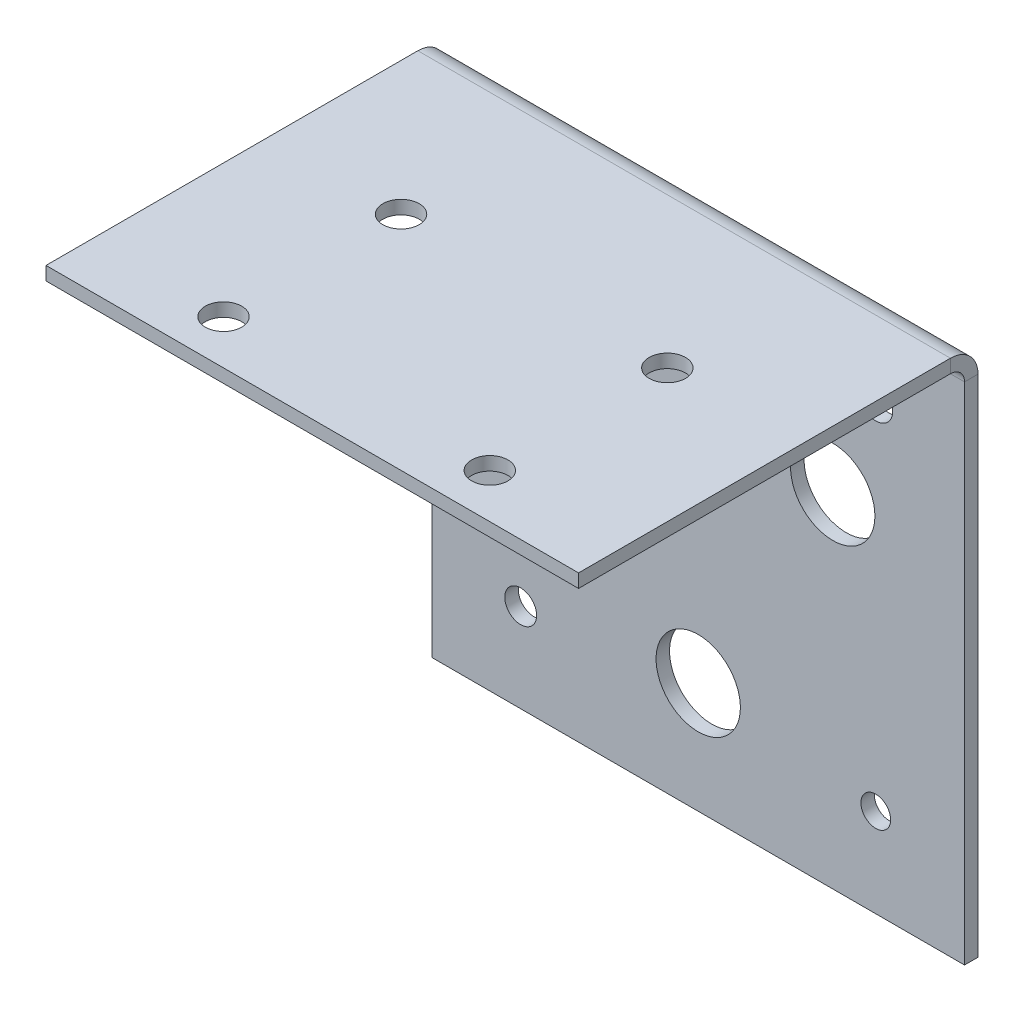
from build123d import *

# Parameters (mm, degrees)
CROQUIS1_W                       = 120
CROQUIS1_H                       = 120
CROQUIS1_R                       = 9.5
BRIDA_BASE1_DEPTH                = 3.03784
BRIDA_DE_ARISTA1_STRIP_W         = 18.50136
BRIDA_DE_ARISTA1_STRIP_H         = 3.03784
BRIDA_DE_ARISTA1_STRIP_CUT_DEPTH = 120
BRIDA_DE_ARISTA1_DEPTH           = 120
CORTAR_EXTRUIR1_REACH            = 161.883
CROQUIS9_R                       = 4.1
CORTAR_EXTRUIR2_REACH            = 125.693
CROQUIS10_R                      = 3.828194302
CROQUIS10_R_2                    = 3.588932158
CROQUIS10_R_3                    = 3.349670014


# Sheet-metal steps are written as plain solids
with BuildPart() as part:
    # Croquis1 → Brida base1 (new body)
    with BuildSketch(Plane.XY):
        Rectangle(CROQUIS1_W, CROQUIS1_H)
        with Locations((0, -35)):
            Circle(CROQUIS1_R, mode=Mode.SUBTRACT)
        with Locations((-30.310889132, 17.5)):
            Circle(CROQUIS1_R, mode=Mode.SUBTRACT)
        with Locations((30.310889132, 17.5)):
            Circle(CROQUIS1_R, mode=Mode.SUBTRACT)
    extrude(amount=-BRIDA_BASE1_DEPTH)

    # Brida de arista1 strip (across the edge) → Brida de arista1 strip cut (cut)
    with BuildSketch(Plane(origin=(60, 60, 0), x_dir=(0, -1, 0), z_dir=(-1, 0, 0))):
        with Locations((-3.03784, -1.51892)):
            Rectangle(BRIDA_DE_ARISTA1_STRIP_W, BRIDA_DE_ARISTA1_STRIP_H)
    extrude(amount=BRIDA_DE_ARISTA1_STRIP_CUT_DEPTH, mode=Mode.SUBTRACT)

    # Brida de arista1 section (across the edge) → Brida de arista1 (add)
    with BuildSketch(Plane(origin=(60, 60, 0), x_dir=(0, -1, 0), z_dir=(-1, 0, 0))):
        with BuildLine():
            Line((0, 3.175), (0, 86.96216))
            Line((0, 86.96216), (3.03784, 86.96216))
            Line((3.03784, 86.96216), (3.03784, 3.175))
            ThreePointArc((3.03784, 3.175), (3.96777597, 0.92993597), (6.21284, 0))
            Line((6.21284, 0), (6.21284, -3.03784))
            ThreePointArc((6.21284, -3.03784), (1.819698706, -1.218141294), (0, 3.175))
        make_face()
    extrude(amount=BRIDA_DE_ARISTA1_DEPTH)

    # Croquis9 → Cortar-Extruir1 (cut, up to next)
    with BuildSketch(Plane(origin=(0, 60, 0), x_dir=(1, 0, 0), z_dir=(0, 1, 0)), mode=Mode.PRIVATE) as cortar_extruir1_sk1:
        with Locations(Location((-30, -76.96216, 0), (0, 0, 270))):
            Circle(CROQUIS9_R)
    cortar_extruir1_tool1 = extrude(cortar_extruir1_sk1.sketch, amount=-CORTAR_EXTRUIR1_REACH, mode=Mode.PRIVATE) & part.part
    # Croquis9 → Cortar-Extruir1 (cut, up to next)
    with BuildSketch(Plane(origin=(0, 60, 0), x_dir=(1, 0, 0), z_dir=(0, 1, 0)), mode=Mode.PRIVATE) as cortar_extruir1_sk2:
        with Locations(Location((-30, -36.96216, 0), (0, 0, 270))):
            Circle(CROQUIS9_R)
    cortar_extruir1_tool2 = extrude(cortar_extruir1_sk2.sketch, amount=-CORTAR_EXTRUIR1_REACH, mode=Mode.PRIVATE) & part.part
    # Croquis9 → Cortar-Extruir1 (cut, up to next)
    with BuildSketch(Plane(origin=(0, 60, 0), x_dir=(1, 0, 0), z_dir=(0, 1, 0)), mode=Mode.PRIVATE) as cortar_extruir1_sk3:
        with Locations(Location((30, -36.96216, 0), (0, 0, 270))):
            Circle(CROQUIS9_R)
    cortar_extruir1_tool3 = extrude(cortar_extruir1_sk3.sketch, amount=-CORTAR_EXTRUIR1_REACH, mode=Mode.PRIVATE) & part.part
    # Croquis9 → Cortar-Extruir1 (cut, up to next)
    with BuildSketch(Plane(origin=(0, 60, 0), x_dir=(1, 0, 0), z_dir=(0, 1, 0)), mode=Mode.PRIVATE) as cortar_extruir1_sk4:
        with Locations(Location((30, -76.96216, 0), (0, 0, 270))):
            Circle(CROQUIS9_R)
    cortar_extruir1_tool4 = extrude(cortar_extruir1_sk4.sketch, amount=-CORTAR_EXTRUIR1_REACH, mode=Mode.PRIVATE) & part.part
    add(cortar_extruir1_tool1.solids().sort_by_distance((-30, 60, 76.96216))[0], mode=Mode.SUBTRACT)
    add(cortar_extruir1_tool2.solids().sort_by_distance((-30, 60, 36.96216))[0], mode=Mode.SUBTRACT)
    add(cortar_extruir1_tool3.solids().sort_by_distance((30, 60, 36.96216))[0], mode=Mode.SUBTRACT)
    add(cortar_extruir1_tool4.solids().sort_by_distance((30, 60, 76.96216))[0], mode=Mode.SUBTRACT)

    # Croquis10 → Cortar-Extruir2 (cut, up to next)
    with BuildSketch(Plane(origin=(0, 0, -3.03784), x_dir=(-1, 0, 0), z_dir=(0, 0, -1)), mode=Mode.PRIVATE) as cortar_extruir2_sk1:
        with Locations((40, 40)):
            Circle(CROQUIS10_R)
    cortar_extruir2_tool1 = extrude(cortar_extruir2_sk1.sketch, amount=-CORTAR_EXTRUIR2_REACH, mode=Mode.PRIVATE) & part.part
    # Croquis10 → Cortar-Extruir2 (cut, up to next)
    with BuildSketch(Plane(origin=(0, 0, -3.03784), x_dir=(-1, 0, 0), z_dir=(0, 0, -1)), mode=Mode.PRIVATE) as cortar_extruir2_sk2:
        with Locations((40, -40)):
            Circle(CROQUIS10_R_2)
    cortar_extruir2_tool2 = extrude(cortar_extruir2_sk2.sketch, amount=-CORTAR_EXTRUIR2_REACH, mode=Mode.PRIVATE) & part.part
    # Croquis10 → Cortar-Extruir2 (cut, up to next)
    with BuildSketch(Plane(origin=(0, 0, -3.03784), x_dir=(-1, 0, 0), z_dir=(0, 0, -1)), mode=Mode.PRIVATE) as cortar_extruir2_sk3:
        with Locations((-40, -40)):
            Circle(CROQUIS10_R_3)
    cortar_extruir2_tool3 = extrude(cortar_extruir2_sk3.sketch, amount=-CORTAR_EXTRUIR2_REACH, mode=Mode.PRIVATE) & part.part
    # Croquis10 → Cortar-Extruir2 (cut, up to next)
    with BuildSketch(Plane(origin=(0, 0, -3.03784), x_dir=(-1, 0, 0), z_dir=(0, 0, -1)), mode=Mode.PRIVATE) as cortar_extruir2_sk4:
        with Locations((-40, 40)):
            Circle(CROQUIS10_R)
    cortar_extruir2_tool4 = extrude(cortar_extruir2_sk4.sketch, amount=-CORTAR_EXTRUIR2_REACH, mode=Mode.PRIVATE) & part.part
    add(cortar_extruir2_tool1.solids().sort_by_distance((-40, 40, -3.03784))[0], mode=Mode.SUBTRACT)
    add(cortar_extruir2_tool2.solids().sort_by_distance((-40, -40, -3.03784))[0], mode=Mode.SUBTRACT)
    add(cortar_extruir2_tool3.solids().sort_by_distance((40, -40, -3.03784))[0], mode=Mode.SUBTRACT)
    add(cortar_extruir2_tool4.solids().sort_by_distance((40, 40, -3.03784))[0], mode=Mode.SUBTRACT)


solid = part.part
